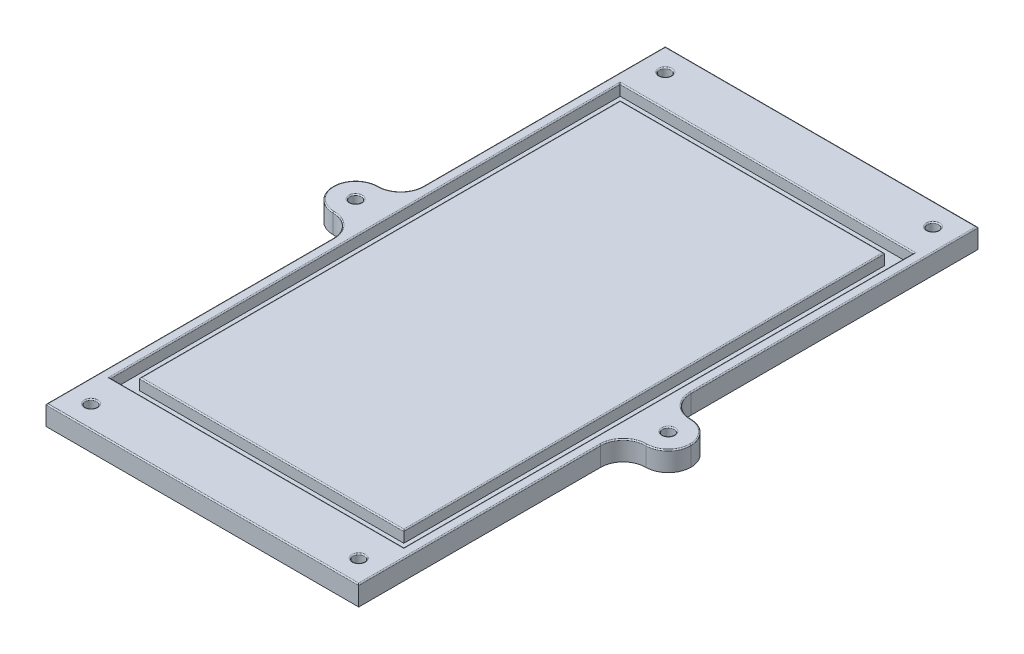
from build123d import *

# Parameters (mm, degrees)
SKIZZE1_W                       = 55.5
SKIZZE1_H                       = 93.9
AUFSATZ_LINEAR_AUSTRAGEN1_DEPTH = 3.5
SKIZZE2_W                       = 52.1
SKIZZE2_H                       = 90.5
SKIZZE2_W_2                     = 46.9
SKIZZE2_H_2                     = 85.3
SCHNITT_LINEAR_AUSTRAGEN1_DEPTH = 2
SKIZZE3_W                       = 55.5
SKIZZE3_H                       = 8
AUFSATZ_LINEAR_AUSTRAGEN2_DEPTH = 3.5
SKIZZE5_W                       = 8
SKIZZE5_H                       = 8
AUFSATZ_LINEAR_AUSTRAGEN3_DEPTH = 3.5
SKIZZE4_R                       = 1
SCHNITT_LINEAR_AUSTRAGEN2_DEPTH = 66.649181259
FASE1_SIZE                      = 1.7
VERRUNDUNG2_DEPTH               = 3.5
VERRUNDUNG2_2_DEPTH             = 3.5
VERRUNDUNG1_R                   = 0.2


with BuildPart() as part:
    # Skizze1 → Aufsatz-Linear austragen1 (new body)
    with BuildSketch(Plane(origin=(0, 0, 0), x_dir=(1, 0, 0), z_dir=(0, 1, 0))):
        Rectangle(SKIZZE1_W, SKIZZE1_H)
    extrude(amount=AUFSATZ_LINEAR_AUSTRAGEN1_DEPTH)

    # Skizze2 → Schnitt-Linear austragen1 (cut)
    with BuildSketch(Plane(origin=(0, 3.5, 0), x_dir=(1, 0, 0), z_dir=(0, 1, 0))):
        Rectangle(SKIZZE2_W, SKIZZE2_H)
        Rectangle(SKIZZE2_W_2, SKIZZE2_H_2, mode=Mode.SUBTRACT)
    extrude(amount=-SCHNITT_LINEAR_AUSTRAGEN1_DEPTH, mode=Mode.SUBTRACT)

    # Skizze3 → Aufsatz-Linear austragen2 (add)
    with BuildSketch(Plane.XZ):
        with Locations((0, 50.95)):
            Rectangle(SKIZZE3_W, SKIZZE3_H)
        with Locations((0, -50.95)):
            Rectangle(SKIZZE3_W, SKIZZE3_H)
    extrude(amount=-AUFSATZ_LINEAR_AUSTRAGEN2_DEPTH)

    # Skizze5 → Aufsatz-Linear austragen3 (add)
    with BuildSketch(Plane.XZ):
        with Locations((31.75, 4)):
            Rectangle(SKIZZE5_W, SKIZZE5_H)
        with Locations((-31.75, -4)):
            Rectangle(SKIZZE5_W, SKIZZE5_H)
    extrude(amount=-AUFSATZ_LINEAR_AUSTRAGEN3_DEPTH)

    # Skizze4 → Schnitt-Linear austragen2 (cut, through all)
    with BuildSketch(Plane(origin=(0, 3.5, 0), x_dir=(1, 0, 0), z_dir=(0, 1, 0))):
        with Locations(Location((-23.75, 50.95, 0), (0, 0, 270))):
            Circle(SKIZZE4_R)
        with Locations(Location((23.75, 50.95, 0), (0, 0, 90))):
            Circle(SKIZZE4_R)
        with Locations(Location((-31.75, 4, 0), (0, 0, 270))):
            Circle(SKIZZE4_R)
        with Locations(Location((31.75, -4, 0), (0, 0, 270))):
            Circle(SKIZZE4_R)
        with Locations(Location((23.75, -50.95, 0), (0, 0, 270))):
            Circle(SKIZZE4_R)
        with Locations(Location((-23.75, -50.95, 0), (0, 0, 90))):
            Circle(SKIZZE4_R)
    extrude(amount=-SCHNITT_LINEAR_AUSTRAGEN2_DEPTH, mode=Mode.SUBTRACT)

    # Fase1
    fase1_edges = [part.edges().sort_by_distance(p)[0] for p in [
        (-23.75, 0, 51.95),
        (23.75, 0, -49.95),
        (-23.75, 0, -51.95),
        (23.75, 0, 49.95),
        (31.75, 0, 3),
        (-31.75, 0, -5),
    ]]
    chamfer(fase1_edges, length=FASE1_SIZE)

    # Verrundung2: read off the stored shape, not the designer's step
    # Verrundung2 outline → Verrundung2 (cut)
    with BuildSketch(Plane(origin=(0, 0, 0), x_dir=(1, 0, 0), z_dir=(0, 1, 0))):
        with BuildLine():
            ThreePointArc((31.75, 0), (34.578427125, -1.171572875), (35.75, -4))
            Line((35.75, -4), (35.75, 0))
            Line((35.75, 0), (31.75, 0))
        make_face()
        with BuildLine():
            ThreePointArc((35.75, -4), (34.578427125, -6.828427125), (31.75, -8))
            Line((31.75, -8), (35.75, -8))
            Line((35.75, -8), (35.75, -4))
        make_face()
        with BuildLine():
            ThreePointArc((-31.75, 0), (-34.578427125, 1.171572875), (-35.75, 4))
            Line((-35.75, 4), (-35.75, 0))
            Line((-35.75, 0), (-31.75, 0))
        make_face()
        with BuildLine():
            ThreePointArc((-35.75, 4), (-34.578427125, 6.828427125), (-31.75, 8))
            Line((-31.75, 8), (-35.75, 8))
            Line((-35.75, 8), (-35.75, 4))
        make_face()
    extrude(amount=VERRUNDUNG2_DEPTH, mode=Mode.SUBTRACT)

    # Verrundung2 2 outline → Verrundung2 2 (add)
    with BuildSketch(Plane(origin=(0, 0, 0), x_dir=(1, 0, 0), z_dir=(0, 1, 0))):
        with BuildLine():
            Line((27.75, -8), (27.75, -12))
            ThreePointArc((27.75, -12), (28.921572875, -9.171572875), (31.75, -8))
            Line((31.75, -8), (27.75, -8))
        make_face()
        with BuildLine():
            Line((27.75, 0), (31.75, 0))
            ThreePointArc((31.75, 0), (28.921572875, 1.171572875), (27.75, 4))
            Line((27.75, 4), (27.75, 0))
        make_face()
        with BuildLine():
            Line((-27.75, 8), (-27.75, 12))
            ThreePointArc((-27.75, 12), (-28.921572875, 9.171572875), (-31.75, 8))
            Line((-31.75, 8), (-27.75, 8))
        make_face()
        with BuildLine():
            Line((-27.75, 0), (-31.75, 0))
            ThreePointArc((-31.75, 0), (-28.921572875, -1.171572875), (-27.75, -4))
            Line((-27.75, -4), (-27.75, 0))
        make_face()
    extrude(amount=VERRUNDUNG2_2_DEPTH)

    # Verrundung1
    verrundung1_edges = [part.edges().sort_by_distance(p)[0] for p in [
        (-23.75, 3.5, 51.95),
        (23.75, 3.5, -49.95),
        (-23.75, 3.5, -51.95),
        (23.75, 3.5, 49.95),
        (-23.75, 1.7, 51.95),
        (23.75, 1.7, 49.95),
        (31.75, 1.7, 3),
        (-31.75, 1.7, -5),
        (-23.75, 1.7, -51.95),
        (23.75, 1.7, -49.95),
        (-27.75, 3.5, -33.475),
        (27.75, 3.5, -29.475),
        (-27.75, 3.5, 29.475),
        (-34.578427125, 3.5, -6.828427125),
        (-34.578427125, 3.5, -1.171572875),
        (34.578427125, 3.5, 6.828427125),
        (34.578427125, 3.5, 1.171572875),
        (28.921572875, 3.5, 9.171572875),
        (28.921572875, 3.5, -1.171572875),
        (-28.921572875, 3.5, 1.171572875),
        (-28.921572875, 3.5, -9.171572875),
        (26.05, 3.5, 0),
        (0, 3.5, -45.25),
        (-26.05, 3.5, 0),
        (0, 3.5, 45.25),
        (23.45, 3.5, 0),
        (0, 3.5, 42.65),
        (-23.45, 3.5, 0),
        (0, 3.5, -42.65),
        (0, 3.5, 54.95),
        (27.75, 3.5, 33.475),
        (0, 3.5, -54.95),
        (31.75, 3.5, 3),
        (-31.75, 3.5, -5),
    ]]
    fillet(verrundung1_edges, radius=VERRUNDUNG1_R)


solid = part.part
